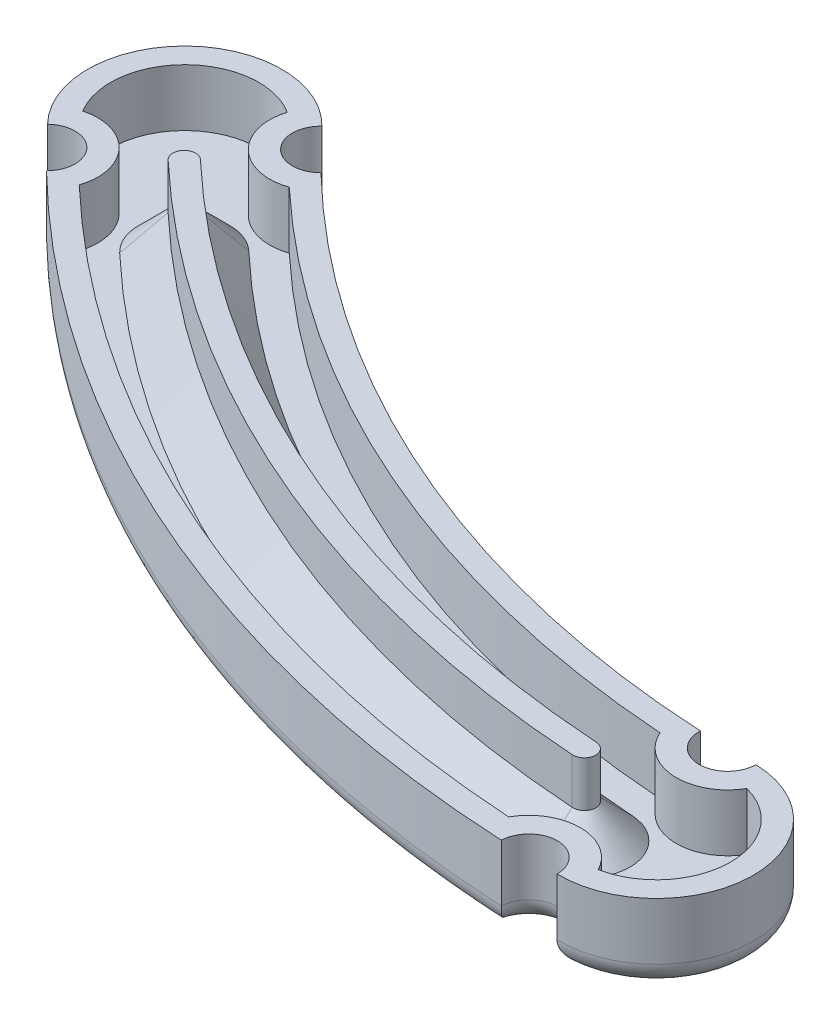
from build123d import *

# Parameters (mm, degrees)
BOSS_EXTRUDE1_DEPTH = 7
FILLET1_R           = 2
SHELL1_START        = 2
SHELL1_DEPTH        = 5
BOSS_EXTRUDE2_DEPTH = 7
CHAMFER2_SIZE       = 3


# Read off the part's stored shape, not the designer's step: Shell1
with BuildPart() as part:
    # Sketch2 → Boss-Extrude1 (new body)
    with BuildSketch(Plane(origin=(0, 0, 0), x_dir=(1, 0, 0), z_dir=(0, 1, 0))):
        with BuildLine():
            ThreePointArc((-0.208151075, -108.497450978), (8.497338934, -100.212675907), (0.217200678, -91.50277552))
            ThreePointArc((0.217200678, -91.50277552), (-2.346486536, -93.970707759), (-4.780740732, -91.375021303))
            ThreePointArc((-4.780740732, -91.375021303), (-36.6, -83.861135218), (-63.746368582, -65.640311491))
            ThreePointArc((-63.746368582, -65.640311491), (-67.304850182, -65.620553623), (-67.23863968, -62.062633186))
            ThreePointArc((-67.23863968, -62.062633186), (-79.255338145, -61.914267797), (-79.41010236, -73.930885555))
            ThreePointArc((-79.41010236, -73.930885555), (-75.896472672, -73.998145219), (-75.921596958, -77.512328796))
            ThreePointArc((-75.921596958, -77.512328796), (-43.4, -99.441892581), (-5.206292309, -108.375017972))
            ThreePointArc((-5.206292309, -108.375017972), (-2.646734863, -105.966951709), (-0.208151075, -108.497450978))
        make_face()
    extrude(amount=BOSS_EXTRUDE1_DEPTH)

    # Fillet1
    fillet1_edges = [part.edges().sort_by_distance(p)[0] for p in [
        (8.497338934, 0, 100.212675907),
        (-2.646734863, 0, 105.966951709),
        (-43.4, 0, 99.441892581),
        (-75.896472672, 0, 73.998145219),
        (-79.255338145, 0, 61.914267797),
        (-67.304850182, 0, 65.620553623),
        (-36.6, 0, 83.861135218),
        (-2.346486536, 0, 93.970707759),
    ]]
    fillet(fillet1_edges, radius=FILLET1_R)

    # Shell1 outline → Shell1 (cut)
    with BuildSketch(Plane(origin=(0, 0, 0), x_dir=(1, 0, 0), z_dir=(0, 1, 0)).offset(SHELL1_START)):
        with BuildLine():
            ThreePointArc((-73.41414546, -77.153180403), (-42.6, -97.608862303), (-6.648027376, -106.292303259))
            ThreePointArc((-6.648027376, -106.292303259), (-2.661816514, -103.96643854), (1.275863774, -106.373552513))
            ThreePointArc((1.275863774, -106.373552513), (6.497554678, -100.178278459), (1.623433321, -93.705997756))
            ThreePointArc((1.623433321, -93.705997756), (-2.520823959, -95.965214247), (-6.402993063, -93.280499998))
            ThreePointArc((-6.402993063, -93.280499998), (-37.4, -85.694165496), (-64.040357054, -68.12549206))
            ThreePointArc((-64.040357054, -68.12549206), (-68.648697048, -67.104644345), (-69.810307104, -62.529757501))
            ThreePointArc((-69.810307104, -62.529757501), (-77.870264225, -63.357143569), (-78.861964379, -71.398536938))
            ThreePointArc((-78.861964379, -71.398536938), (-74.419416665, -72.648854313), (-73.41414546, -77.153180403))
        make_face()
    extrude(amount=SHELL1_DEPTH, mode=Mode.SUBTRACT)

    # Sketch3 → Boss-Extrude2 (add)
    with BuildSketch(Plane(origin=(0, 2, 0), x_dir=(1, 0, 0), z_dir=(0, 1, 0))):
        with BuildLine():
            ThreePointArc((-69.414526923, -73.365732927), (-40.399816467, -92.56760851), (-6.590765621, -100.784270223))
            ThreePointArc((-6.590765621, -100.784270223), (-5.527641624, -99.85165703), (-6.460254818, -98.788533033))
            ThreePointArc((-6.460254818, -98.788533033), (-39.599816467, -90.734578232), (-68.039975591, -71.912939536))
            ThreePointArc((-68.039975591, -71.912939536), (-69.453647952, -71.952060566), (-69.414526923, -73.365732927))
        make_face()
    extrude(amount=BOSS_EXTRUDE2_DEPTH)

    # Chamfer2
    chamfer2_edges = [part.edges().sort_by_distance(p)[0] for p in [
        (-69.453647952, 2, 71.952060566),
        (-40.399816467, 2, 92.56760851),
        (-5.527641624, 2, 99.85165703),
        (-39.599816467, 2, 90.734578232),
    ]]
    chamfer(chamfer2_edges, length=CHAMFER2_SIZE)


solid = part.part
